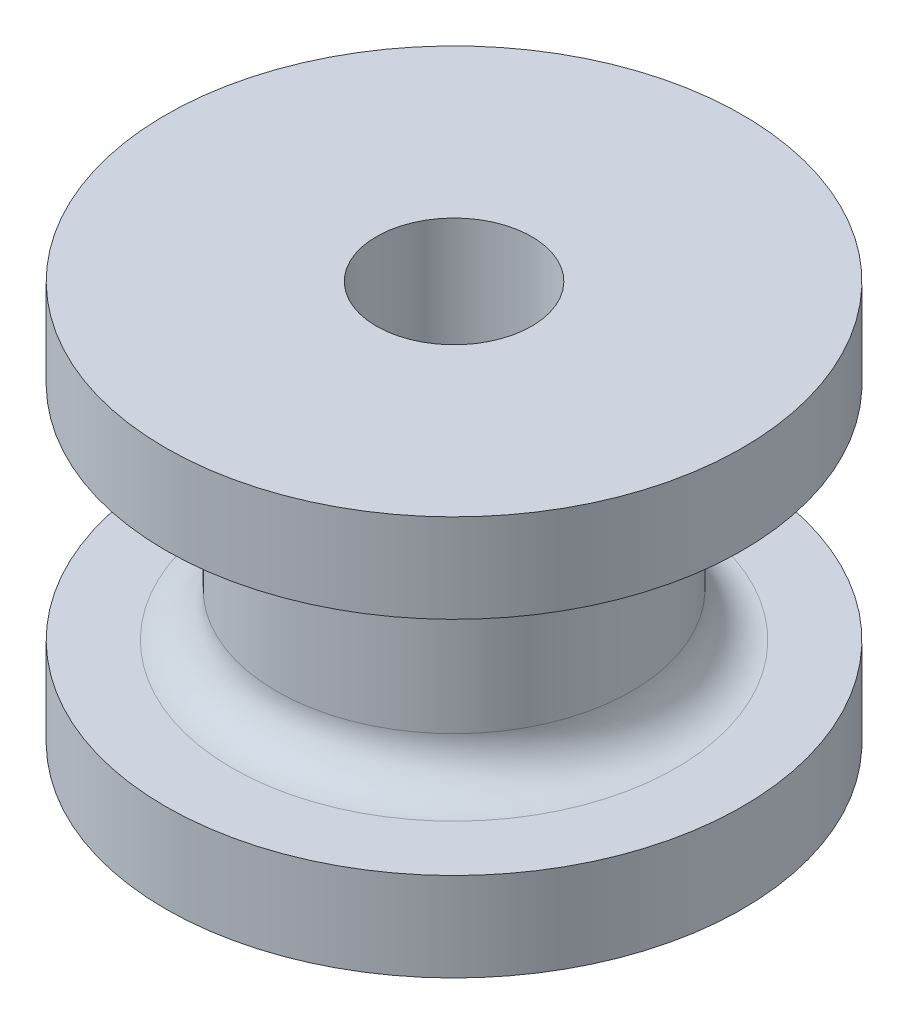
from build123d import *

# Parameters (mm, degrees)
HUB_START          = -2.25
HUB_HOLE_OUTLINE_R = 0.875
HUB_HOLE_DEPTH     = 4.5


# Read off the part's stored shape, not the designer's step: Hub Hole
with BuildPart() as part:
    # Sketch3 → Revolve1 (revolve)
    with BuildSketch(Plane(origin=(0, 0, 0), x_dir=(0, 0, -1), z_dir=(1, 0, 0)), mode=Mode.PRIVATE) as revolve1_sk:
        with BuildLine():
            Line((0, 2.25), (3.25, 2.25))
            Line((3.25, 2.25), (3.25, 1.25))
            Line((3.25, 1.25), (2.5, 1.25))
            ThreePointArc((2.5, 1.25), (2.146446609, 1.103553391), (2, 0.75))
            Line((2, 0.75), (2, -0.75))
            ThreePointArc((2, -0.75), (2.146446609, -1.103553391), (2.5, -1.25))
            Line((2.5, -1.25), (3.25, -1.25))
            Line((3.25, -1.25), (3.25, -2.25))
            Line((3.25, -2.25), (0, -2.25))
            Line((0, -2.25), (0, 2.25))
        make_face()
    revolve(revolve1_sk.sketch.rotate(Axis((0, 2.25, 0), (0, -1, 0)), 180), axis=Axis((0, 2.25, 0), (0, -1, 0)))

    # Hub Hole outline → Hub Hole (cut)
    with BuildSketch(Plane(origin=(0, 0, 0), x_dir=(1, 0, 0), z_dir=(0, 1, 0)).offset(HUB_START)):
        Circle(HUB_HOLE_OUTLINE_R)
    extrude(amount=HUB_HOLE_DEPTH, mode=Mode.SUBTRACT)


solid = part.part
